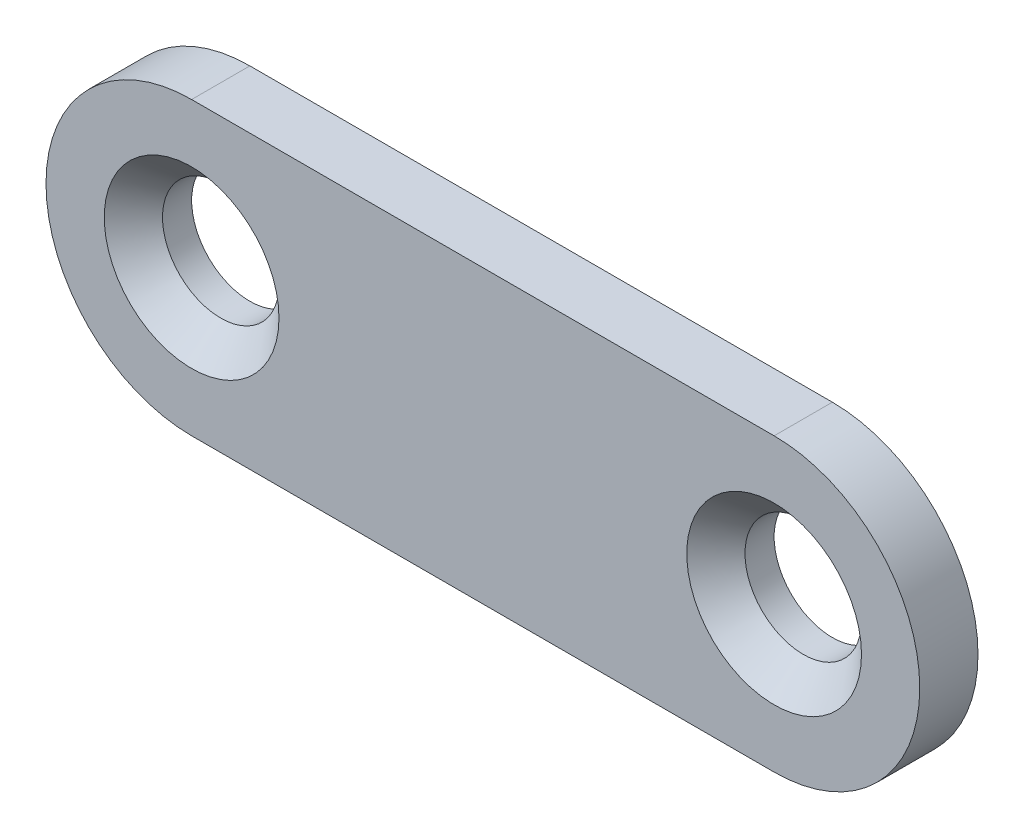
from build123d import *

# Parameters (mm, degrees)
ESQUISSE1_R        = 2
BOSS_EXTRU_1_DEPTH = 2
CHANFREIN1_SIZE    = 1


with BuildPart() as part:
    # Esquisse1 → Boss.-Extru.1 (new body)
    with BuildSketch(Plane.XY):
        with BuildLine():
            Line((20, 0), (0, 0))
            ThreePointArc((0, 0), (-5, -5), (0, -10))
            Line((0, -10), (20, -10))
            ThreePointArc((20, -10), (25, -5), (20, 0))
        make_face()
        with Locations((20, -5)):
            Circle(ESQUISSE1_R, mode=Mode.SUBTRACT)
        with Locations((0, -5)):
            Circle(ESQUISSE1_R, mode=Mode.SUBTRACT)
    extrude(amount=BOSS_EXTRU_1_DEPTH)

    # Chanfrein1
    chanfrein1_edges = [part.edges().sort_by_distance(p)[0] for p in [
        (18, -5, 2),
        (-2, -5, 2),
    ]]
    chamfer(chanfrein1_edges, length=CHANFREIN1_SIZE)


solid = part.part
